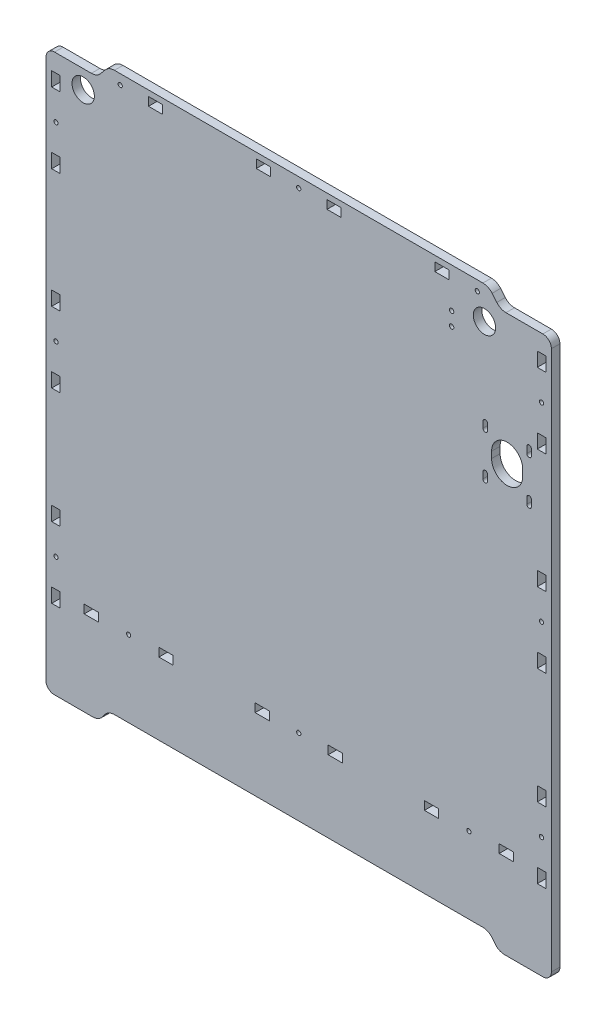
from build123d import *

# Parameters (mm, degrees)
SKETCH_1_R      = 1.55
SKETCH_1_R_2    = 7.9
SKETCH_1_R_3    = 1.500000002
SKETCH_1_R_4    = 1.500000001
SKETCH_1_R_5    = 1.5
SKETCH_1_W      = 6
SKETCH_1_H      = 10
SKETCH_1_W_2    = 10
SKETCH_1_H_2    = 6
EXTRUDE_1_DEPTH = 6


with BuildPart() as part:
    # Эскиз1 → Бобышка-Вытянуть1 (new body)
    with BuildSketch(Plane.XY):
        with BuildLine():
            Line((146.728432874, 193.302051095), (172.76481778, 193.302051095))
            ThreePointArc((172.76481778, 193.302051095), (177.038597027, 191.56796477), (178.819099243, 187.313313634))
            Line((178.819099243, 187.313313634), (178.819099243, -193.997737318))
            ThreePointArc((178.819099243, -193.997737318), (177.04259214, -198.259685315), (172.764817781, -199.997737318))
            Line((172.764817781, -199.997737318), (145.728432875, -199.997737318))
            ThreePointArc((145.728432875, -199.997737318), (142.13617765, -199.201353507), (139.217055109, -196.961432))
            Line((139.217055109, -196.961432), (136.921229056, -193.941778905))
            ThreePointArc((136.921229056, -193.941778905), (134.002106514, -191.701857397), (130.409851289, -190.905473587))
            Line((130.409851289, -190.905473587), (-129.880215727, -190.905473587))
            ThreePointArc((-129.880215727, -190.905473587), (-133.472470952, -191.701857397), (-136.391593494, -193.941778905))
            Line((-136.391593494, -193.941778905), (-138.687419547, -196.961432))
            ThreePointArc((-138.687419547, -196.961432), (-141.606542089, -199.201353507), (-145.198797313, -199.997737318))
            Line((-145.198797313, -199.997737318), (-172.235182219, -199.997737318))
            ThreePointArc((-172.235182219, -199.997737318), (-175.957867453, -198.836968562), (-178.180900757, -195.633237551))
            Line((-178.180900757, -195.633237551), (-178.180900757, 187.302262682))
            ThreePointArc((-178.180900757, 187.302262682), (-176.423541444, 191.54490337), (-172.180900757, 193.302262682))
            Line((-172.180900757, 193.302262682), (-146.198797314, 193.302262682))
            ThreePointArc((-146.198797314, 193.302262682), (-142.60654209, 194.098646493), (-139.687419548, 196.338568))
            Line((-139.687419548, 196.338568), (-136.391593495, 200.265957365))
            ThreePointArc((-136.391593495, 200.265957365), (-133.472470953, 202.505878872), (-129.880215728, 203.302262682))
            Line((-129.880215728, 203.302262682), (130.409851288, 203.302262682))
            ThreePointArc((130.409851288, 203.302262682), (134.002106513, 202.505878872), (136.921229055, 200.265957365))
            Line((136.921229055, 200.265957365), (140.217104458, 196.338462243))
            ThreePointArc((140.217104458, 196.338462243), (143.136190594, 194.098493291), (146.728432874, 193.302051095))
        make_face()
        with Locations((108.319099243, 165.602262682)):
            Circle(SKETCH_1_R, mode=Mode.SUBTRACT)
        with Locations((108.319099243, 175.302262682)):
            Circle(SKETCH_1_R, mode=Mode.SUBTRACT)
        with Locations((131.519099243, 180.302262682)):
            Circle(SKETCH_1_R_2, mode=Mode.SUBTRACT)
        with Locations((-151.980900757, 180.302262682)):
            Circle(SKETCH_1_R_2, mode=Mode.SUBTRACT)
        with Locations((-171.180900757, 150.902262682)):
            Circle(SKETCH_1_R_3, mode=Mode.SUBTRACT)
        with Locations((-171.180900757, 16.742262682)):
            Circle(SKETCH_1_R_4, mode=Mode.SUBTRACT)
        with Locations((171.819099243, 150.902051095)):
            Circle(SKETCH_1_R_4, mode=Mode.SUBTRACT)
        with Locations((126.459099243, 196.302262682)):
            Circle(SKETCH_1_R_5, mode=Mode.SUBTRACT)
        with Locations((-125.820900757, 196.302262682)):
            Circle(SKETCH_1_R_5, mode=Mode.SUBTRACT)
        with Locations((0.319099243, 196.302262682)):
            Circle(SKETCH_1_R_5, mode=Mode.SUBTRACT)
        with Locations((-119.870900757, -136.997737318)):
            Circle(SKETCH_1_R_5, mode=Mode.SUBTRACT)
        with Locations((-171.180900757, -114.967737318)):
            Circle(SKETCH_1_R_5, mode=Mode.SUBTRACT)
        with Locations((0.319099243, -136.997737318)):
            Circle(SKETCH_1_R_5, mode=Mode.SUBTRACT)
        with Locations((120.509099243, -136.997737318)):
            Circle(SKETCH_1_R_5, mode=Mode.SUBTRACT)
        with Locations((171.819099243, -114.967948905)):
            Circle(SKETCH_1_R_5, mode=Mode.SUBTRACT)
        with Locations((171.819099244, 16.742051095)):
            Circle(SKETCH_1_R_5, mode=Mode.SUBTRACT)
        with BuildLine():
            Line((133.65547985, 83.46981119), (133.65547985, 87.96981119))
            ThreePointArc((133.65547985, 87.96981119), (132.05547985, 89.56981119), (130.45547985, 87.96981119))
            Line((130.45547985, 87.96981119), (130.45547985, 83.46981119))
            ThreePointArc((130.45547985, 83.46981119), (132.05547985, 81.86981119), (133.65547985, 83.46981119))
        make_face(mode=Mode.SUBTRACT)
        with BuildLine():
            Line((133.65547985, 118.96981119), (133.65547985, 114.46981119))
            ThreePointArc((133.65547985, 114.46981119), (132.05547985, 112.86981119), (130.45547985, 114.46981119))
            Line((130.45547985, 114.46981119), (130.45547985, 118.96981119))
            ThreePointArc((130.45547985, 118.96981119), (132.05547985, 120.56981119), (133.65547985, 118.96981119))
        make_face(mode=Mode.SUBTRACT)
        with BuildLine():
            Line((158.55547985, 98.96981119), (158.55547985, 103.46981119))
            ThreePointArc((158.55547985, 103.46981119), (147.55547985, 114.46981119), (136.55547985, 103.46981119))
            Line((136.55547985, 103.46981119), (136.55547985, 98.96981119))
            ThreePointArc((136.55547985, 98.96981119), (147.55547985, 87.96981119), (158.55547985, 98.96981119))
        make_face(mode=Mode.SUBTRACT)
        with BuildLine():
            Line((161.45547985, 118.96981119), (161.45547985, 114.46981119))
            ThreePointArc((161.45547985, 114.46981119), (163.05547985, 112.86981119), (164.65547985, 114.46981119))
            Line((164.65547985, 114.46981119), (164.65547985, 118.96981119))
            ThreePointArc((164.65547985, 118.96981119), (163.05547985, 120.56981119), (161.45547985, 118.96981119))
        make_face(mode=Mode.SUBTRACT)
        with BuildLine():
            Line((161.45547985, 83.46981119), (161.45547985, 87.96981119))
            ThreePointArc((161.45547985, 87.96981119), (163.05547985, 89.56981119), (164.65547985, 87.96981119))
            Line((164.65547985, 87.96981119), (164.65547985, 83.46981119))
            ThreePointArc((164.65547985, 83.46981119), (163.05547985, 81.86981119), (161.45547985, 83.46981119))
        make_face(mode=Mode.SUBTRACT)
        with Locations((-171.180900756, 41.742262682)):
            Rectangle(SKETCH_1_W, SKETCH_1_H, mode=Mode.SUBTRACT)
        with Locations((94.109099243, -136.997737318)):
            Rectangle(SKETCH_1_W_2, SKETCH_1_H_2, mode=Mode.SUBTRACT)
        with Locations((146.909099243, -136.997737318)):
            Rectangle(SKETCH_1_W_2, SKETCH_1_H_2, mode=Mode.SUBTRACT)
        with Locations((-24.670900757, 196.302262682)):
            Rectangle(SKETCH_1_W_2, SKETCH_1_H_2, mode=Mode.SUBTRACT)
        with Locations((25.309099243, 196.302262682)):
            Rectangle(SKETCH_1_W_2, SKETCH_1_H_2, mode=Mode.SUBTRACT)
        with Locations((-146.270900757, -136.997737318)):
            Rectangle(SKETCH_1_W_2, SKETCH_1_H_2, mode=Mode.SUBTRACT)
        with Locations((-93.470900757, -136.997737318)):
            Rectangle(SKETCH_1_W_2, SKETCH_1_H_2, mode=Mode.SUBTRACT)
        with Locations((-25.470900757, -136.997737318)):
            Rectangle(SKETCH_1_W_2, SKETCH_1_H_2, mode=Mode.SUBTRACT)
        with Locations((26.109099243, -136.997737318)):
            Rectangle(SKETCH_1_W_2, SKETCH_1_H_2, mode=Mode.SUBTRACT)
        with Locations((-171.180900757, -8.257737318)):
            Rectangle(SKETCH_1_W, SKETCH_1_H, mode=Mode.SUBTRACT)
        with Locations((-171.180900757, 175.902262682)):
            Rectangle(SKETCH_1_W, SKETCH_1_H, mode=Mode.SUBTRACT)
        with Locations((-171.180900757, 125.902262682)):
            Rectangle(SKETCH_1_W, SKETCH_1_H, mode=Mode.SUBTRACT)
        with Locations((-171.180900756, -89.987737318)):
            Rectangle(SKETCH_1_W, SKETCH_1_H, mode=Mode.SUBTRACT)
        with Locations((-171.180900757, -139.977737318)):
            Rectangle(SKETCH_1_W, SKETCH_1_H, mode=Mode.SUBTRACT)
        with Locations((171.819099243, 41.742051095)):
            Rectangle(SKETCH_1_W, SKETCH_1_H, mode=Mode.SUBTRACT)
        with Locations((171.819099243, -8.257948905)):
            Rectangle(SKETCH_1_W, SKETCH_1_H, mode=Mode.SUBTRACT)
        with Locations((171.819099244, -89.987948905)):
            Rectangle(SKETCH_1_W, SKETCH_1_H, mode=Mode.SUBTRACT)
        with Locations((171.819099243, -139.977948905)):
            Rectangle(SKETCH_1_W, SKETCH_1_H, mode=Mode.SUBTRACT)
        Polygon((168.819099243, 170.902051095), (168.819099243, 180.902051095), (174.819099243, 180.902051095), (174.819099243, 170.978103712), (175.145177162, 170.902051095), align=None, mode=Mode.SUBTRACT)
        with Locations((171.819099243, 125.902051095)):
            Rectangle(SKETCH_1_W, SKETCH_1_H, mode=Mode.SUBTRACT)
        with Locations((-100.820900757, 196.302262682)):
            Rectangle(SKETCH_1_W_2, SKETCH_1_H_2, mode=Mode.SUBTRACT)
        with Locations((101.459099243, 196.302262682)):
            Rectangle(SKETCH_1_W_2, SKETCH_1_H_2, mode=Mode.SUBTRACT)
    extrude(amount=EXTRUDE_1_DEPTH)


solid = part.part
